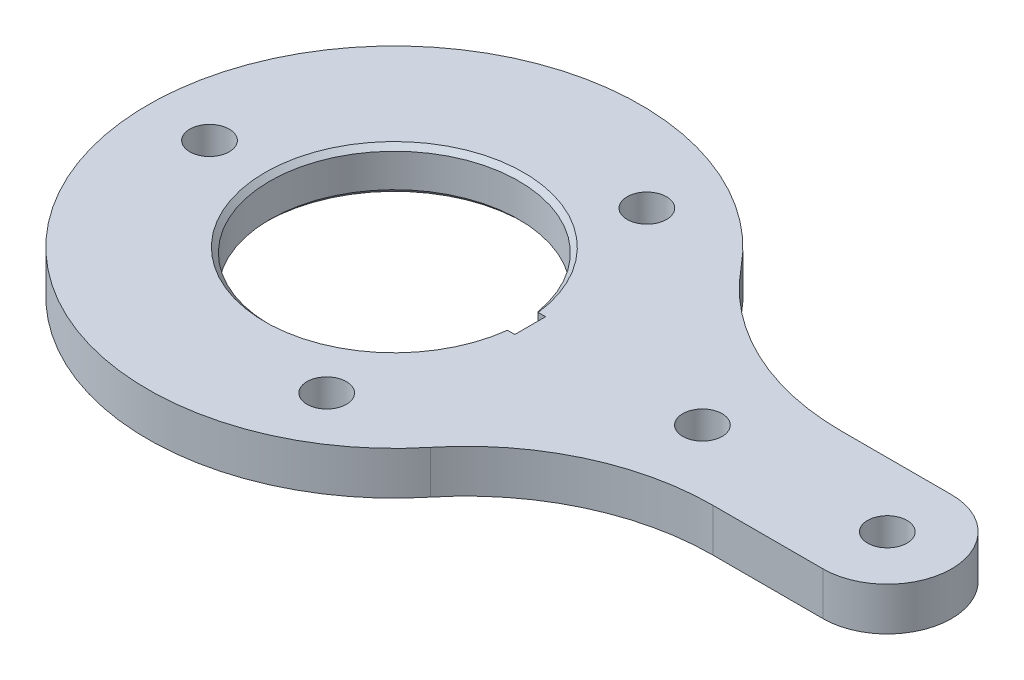
from build123d import *

# Parameters (mm, degrees)
SKETCH1_W           = 70
SKETCH1_H           = 3.5
BOSS_EXTRUDE1_DEPTH = 25
SKETCH2_R           = 10.1
SKETCH2_R_2         = 1.6
CUT_EXTRUDE1_DEPTH  = 44.153794735
SKETCH4_OUTSIDE_W   = 89.218
SKETCH4_OUTSIDE_H   = 69.218
CUT_EXTRUDE2_DEPTH  = 44.153794735
SKETCH5_W           = 1
SKETCH5_H           = 2.5
CUT_EXTRUDE3_DEPTH  = 40.601136347
CHAMFER1_SIZE       = 0.460537939
CHAMFER1_SIZE_2     = 0.4


with BuildPart() as part:
    # Sketch1 → Boss-Extrude1 (new, symmetric)
    with BuildSketch(Plane.XY):
        Rectangle(SKETCH1_W, SKETCH1_H)
    extrude(amount=BOSS_EXTRUDE1_DEPTH, both=True)

    # Sketch2 → Cut-Extrude1 (cut, through all)
    with BuildSketch(Plane(origin=(0, 1.75, 0), x_dir=(1, 0, 0), z_dir=(0, 1, 0))):
        with Locations(Location((-14, 0, 0), (0, 0, 180))):
            Circle(SKETCH2_R)
        with Locations((-29, 0)):
            Circle(SKETCH2_R_2)
        with Locations(Location((-6.5, 12.990381057, 0), (0, 0, 180))):
            Circle(SKETCH2_R_2)
        with Locations(Location((-6.5, -12.990381057, 0), (0, 0, 180))):
            Circle(SKETCH2_R_2)
        with Locations(Location((11, 0, 0), (0, 0, 180))):
            Circle(SKETCH2_R_2)
        with Locations(Location((26, 0, 0), (0, 0, 180))):
            Circle(SKETCH2_R_2)
    extrude(amount=-CUT_EXTRUDE1_DEPTH, mode=Mode.SUBTRACT)

    # Sketch4 outside → Cut-Extrude2 (cut, through all)
    with BuildSketch(Plane(origin=(0, 1.75, 0), x_dir=(1, 0, 0), z_dir=(0, 1, 0))):
        Rectangle(SKETCH4_OUTSIDE_W, SKETCH4_OUTSIDE_H)
        with BuildLine():
            Line((17.054712149, -5.214702174), (26, -5.214702174))
            ThreePointArc((26, -5.214702174), (31.214702174, 0), (26, 5.214702174))
            Line((26, 5.214702174), (17.054712149, 5.214702174))
            ThreePointArc((17.054712149, 5.214702174), (8.454737914, 7.157470503), (1.525041378, 12.608453125))
            ThreePointArc((1.525041378, 12.608453125), (-34, 0), (1.525041378, -12.608453125))
            ThreePointArc((1.525041378, -12.608453125), (8.454737914, -7.157470503), (17.054712149, -5.214702174))
        make_face(mode=Mode.SUBTRACT)
    extrude(amount=-CUT_EXTRUDE2_DEPTH, mode=Mode.SUBTRACT)

    # Sketch5 → Cut-Extrude3 (cut, through all)
    with BuildSketch(Plane(origin=(0, 1.75, 0), x_dir=(1, 0, 0), z_dir=(0, 1, 0))):
        with Locations((-3.477649976, 0)):
            Rectangle(SKETCH5_W, SKETCH5_H)
    extrude(amount=-CUT_EXTRUDE3_DEPTH, mode=Mode.SUBTRACT)

    # Chamfer1
    # the kernel refuses this chamfer: 0.460537939, 0.4 mm, written as the material it takes off along each edge
    with BuildSketch(Plane(origin=(-3.977649976, 2.93802649, 1.25), x_dir=(1, 0, 0), z_dir=(0, -1, 0))) as chamfer1_piece_1:
        with BuildLine():
            Line((CHAMFER1_SIZE, 0), (-0.058717526, 0.404094149))
            ThreePointArc((-0.058717526, 0.404094149), (-0.028274639, 0.208923305), (0, 0))
            Line((0, 0), (CHAMFER1_SIZE, 0))
        make_face()
    extrude(amount=5.876052981, mode=Mode.SUBTRACT)
    with BuildSketch(Plane(origin=(-3.977649976, 2.974865586, -1.25), x_dir=(-0.1470633692519934, 0, -0.9891270724352114), z_dir=(0, -1, 0))) as chamfer1_piece_2:
        with BuildLine():
            Line((0.475023444, 0), (-CHAMFER1_SIZE_2 * 0.147063369252, CHAMFER1_SIZE_2 * 0.989127072435))
            Line((-CHAMFER1_SIZE_2 * 0.147063369252, CHAMFER1_SIZE_2 * 0.989127072435), (0, 0))
            ThreePointArc((0, 0), (0.244917786, 0.002790335), (0.475023444, 0))
        make_face()
    extrude(amount=5.949731171, mode=Mode.SUBTRACT)
    # the kernel refuses this chamfer: 0.460537939, 0.4 mm, written as the material it takes off along each edge
    with BuildSketch(Plane(origin=(-14, -1.75, 0), x_dir=(0.9980739544649045, 0, 0.062035323959722194), z_dir=(0.062035323959722194, 0, -0.9980739544649045))) as chamfer1_2_piece_1:
        Polygon((10.1 + CHAMFER1_SIZE_2, 0), (10.1, -CHAMFER1_SIZE_2), (10.1, 0), align=None)
    revolve(axis=Axis((-14, -1.75, 0), (0, -1, 0)), revolution_arc=352.508320322, mode=Mode.SUBTRACT)
    with BuildSketch(Plane(origin=(-14, 1.75, 0), x_dir=(0.9980739544649045, 0, 0.06203532395972309), z_dir=(0.06203532395972309, 0, -0.9980739544649045))) as chamfer1_2_piece_2:
        Polygon((10.1 + CHAMFER1_SIZE_2, 0), (10.1, CHAMFER1_SIZE_2), (10.1, 0), align=None)
    revolve(axis=Axis((-14, 1.75, 0), (0, -1, 0)), revolution_arc=352.508320322, mode=Mode.SUBTRACT)


solid = part.part
